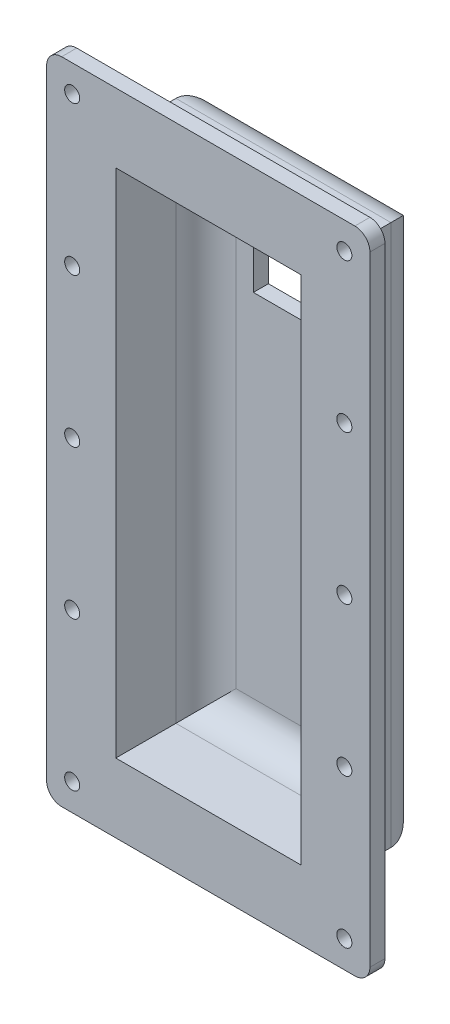
from build123d import *

# Parameters (mm, degrees)
SKETCH1_W           = 35.76
SKETCH1_H           = 90
BOSS_EXTRUDE1_DEPTH = 15
SKETCH2_W           = 53.76
SKETCH2_H           = 108
BOSS_EXTRUDE2_DEPTH = 2.5
SHELL1_START        = -15.38
SHELL1_OUTLINE_W    = 85
SHELL1_OUTLINE_H    = 15
SHELL1_DEPTH        = 30.76
FILLET1_R           = 2.5
FILLET2_R           = 5
SKETCH3_W           = 15
SKETCH3_H           = 8
CUT_EXTRUDE1_DEPTH  = 63.15733585
SKETCH4_R           = 1.25
CUT_EXTRUDE2_DEPTH  = 2.5


# Read off the part's stored shape, not the designer's step: Shell1
with BuildPart() as part:
    # Sketch1 → Boss-Extrude1 (new body)
    with BuildSketch(Plane.XY):
        Rectangle(SKETCH1_W, SKETCH1_H)
    extrude(amount=BOSS_EXTRUDE1_DEPTH)

    # Sketch2 → Boss-Extrude2 (add)
    with BuildSketch(Plane.XY.offset(15)):
        Rectangle(SKETCH2_W, SKETCH2_H)
    extrude(amount=BOSS_EXTRUDE2_DEPTH)

    # Shell1 outline → Shell1 (cut)
    with BuildSketch(Plane.YZ.offset(SHELL1_START)):
        with Locations((0, 10)):
            Rectangle(SHELL1_OUTLINE_W, SHELL1_OUTLINE_H)
    extrude(amount=SHELL1_DEPTH, mode=Mode.SUBTRACT)

    # Fillet1
    fillet1_edges = [part.edges().sort_by_distance(p)[0] for p in [
        (26.88, -54, 16.25),
        (26.88, 54, 16.25),
        (-26.88, 54, 16.25),
        (-26.88, -54, 16.25),
    ]]
    fillet(fillet1_edges, radius=FILLET1_R)

    # Fillet2
    fillet2_edges = [part.edges().sort_by_distance(p)[0] for p in [
        (15.38, 0, 2.5),
        (0, 42.5, 2.5),
        (-15.38, 0, 2.5),
        (0, -42.5, 2.5),
        (0, -45, 0),
        (-17.88, 0, 0),
        (0, 45, 0),
        (17.88, 0, 0),
    ]]
    fillet(fillet2_edges, radius=FILLET2_R)

    # Sketch3 → Cut-Extrude1 (cut, through all)
    with BuildSketch(Plane.XY.offset(2.5)):
        with Locations((0, 25)):
            Rectangle(SKETCH3_W, SKETCH3_H)
    extrude(amount=-CUT_EXTRUDE1_DEPTH, mode=Mode.SUBTRACT)

    # Sketch4 → Cut-Extrude2 (cut)
    with BuildSketch(Plane.XY.offset(17.5)):
        with Locations((-22.63, 49.5)):
            Circle(SKETCH4_R)
        with Locations((22.63, 49.5)):
            Circle(SKETCH4_R)
        with Locations((22.63, 24.75)):
            Circle(SKETCH4_R)
        with Locations((22.63, 0)):
            Circle(SKETCH4_R)
        with Locations((22.63, -24.75)):
            Circle(SKETCH4_R)
        with Locations((22.63, -49.5)):
            Circle(SKETCH4_R)
        with Locations((-22.63, 24.75)):
            Circle(SKETCH4_R)
        with Locations((-22.63, 0)):
            Circle(SKETCH4_R)
        with Locations((-22.63, -24.75)):
            Circle(SKETCH4_R)
        with Locations((-22.63, -49.5)):
            Circle(SKETCH4_R)
    extrude(amount=-CUT_EXTRUDE2_DEPTH, mode=Mode.SUBTRACT)


solid = part.part
